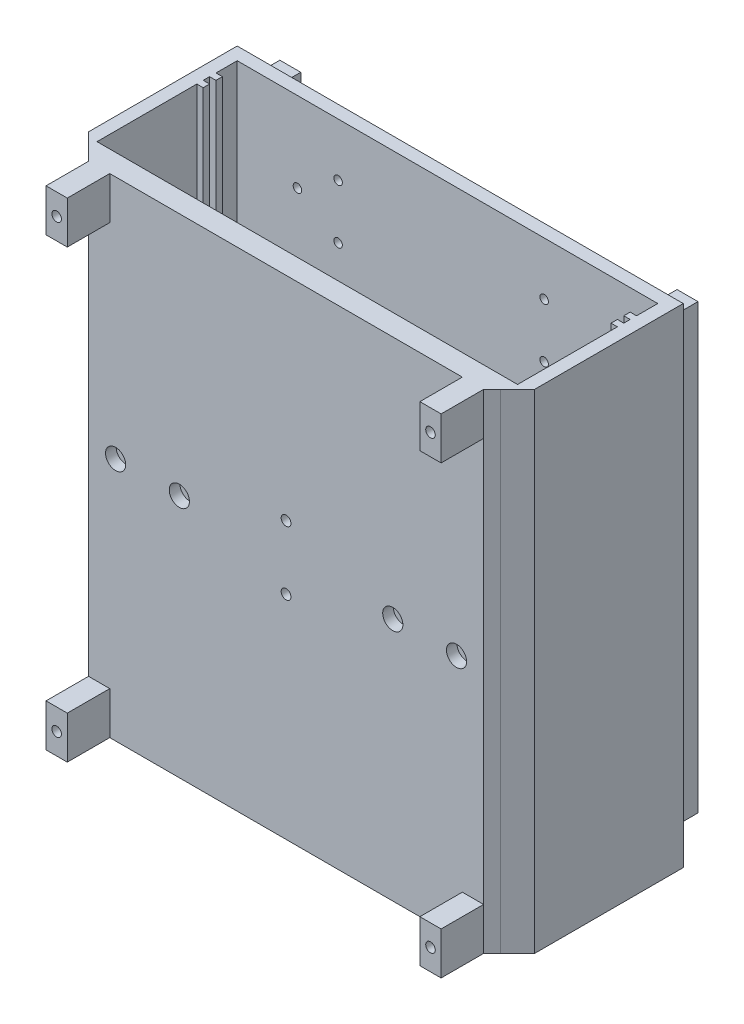
from build123d import *

# Parameters (mm, degrees)
SKETCH_1_W           = 210
SKETCH_1_H           = 230
EXTRUDE_1_DEPTH      = 6
SKETCH_2_W           = 9.85
SKETCH_2_H           = 208.5
EXTRUDE_3_DEPTH      = 15
SKETCH_3_R           = 2
CUT_EXTRUDE_1_DEPTH  = 10
SKETCH_17_W          = 6
SKETCH_17_H          = 230
EXTRUDE_9_DEPTH      = 66
EXTRUDE_10_DEPTH     = 6
CHAMFER_3_SIZE       = 8
SKETCH_21_R          = 2.3
CUT_EXTRUDE_9_DEPTH  = 6
SKETCH_34_R          = 2.25
CUT_EXTRUDE_14_DEPTH = 30
SKETCH_36_R          = 2.25
CUT_EXTRUDE_15_DEPTH = 30
SKETCH_51_W          = 194
SKETCH_51_H          = 230
EXTRUDE_22_DEPTH     = 4
CHAMFER_6_SIZE       = 4
CUT_EXTRUDE_START    = -5
SKETCH_54_R          = 4.75
SKETCH_54_R_2        = 2.3
CUT_EXTRUDE_21_DEPTH = 5
CUT_EXTRUDE_23_REACH = 324.062
SKETCH_60_W          = 25
SKETCH_60_H          = 30
SKETCH_61_W          = 3
SKETCH_61_H          = 3
EXTRUDE_25_DEPTH     = 230
SKETCH_63_W          = 5
SKETCH_63_H          = 8
EXTRUDE_26_DEPTH     = 3
SKETCH_65_W          = 5
SKETCH_65_H          = 8
EXTRUDE_27_DEPTH     = 3
SKETCH_64_R          = 1.15
CUT_EXTRUDE_24_DEPTH = 9
SKETCH_66_W          = 5
SKETCH_66_H          = 8
EXTRUDE_28_DEPTH     = 3
SKETCH_67_W          = 5
SKETCH_67_H          = 8
EXTRUDE_29_DEPTH     = 3
SKETCH_68_R          = 1.15
CUT_EXTRUDE_25_DEPTH = 9
SKETCH_69_W          = 10
SKETCH_69_H          = 20
EXTRUDE_30_DEPTH     = 20
SKETCH_70_W          = 10
SKETCH_70_H          = 20
EXTRUDE_31_DEPTH     = 20
SKETCH_72_R          = 2.25
CUT_EXTRUDE_26_DEPTH = 20


with BuildPart() as part:
    # 草图1 → 凸台-拉伸1 (new body)
    with BuildSketch(Plane.XY):
        with Locations((105, 115)):
            Rectangle(SKETCH_1_W, SKETCH_1_H)
    extrude(amount=EXTRUDE_1_DEPTH)

    # 草图2 → 凸台-拉伸3 (add)
    with BuildSketch(Plane(origin=(0, 0, 0), x_dir=(-1, 0, 0), z_dir=(0, 0, -1))):
        with Locations((-197, 115)):
            Rectangle(SKETCH_2_W, SKETCH_2_H)
        with Locations((-10, 115)):
            Rectangle(SKETCH_2_W, SKETCH_2_H)
    extrude(amount=EXTRUDE_3_DEPTH)

    # 草图3 → 切除-拉伸1 (cut)
    with BuildSketch(Plane(origin=(0, 0, 0), x_dir=(-1, 0, 0), z_dir=(0, 0, -1))):
        with Locations((-169.6425573, 192.25)):
            Circle(SKETCH_3_R)
        with Locations((-150.5, 205)):
            Circle(SKETCH_3_R)
        with Locations((-150.5, 179.5)):
            Circle(SKETCH_3_R)
        with Locations(Location((-150.5, 50.5, 0), (0, 0, 180))):
            Circle(SKETCH_3_R)
        with Locations(Location((-150.5, 25, 0), (0, 0, 180))):
            Circle(SKETCH_3_R)
        with Locations(Location((-169.6425573, 37.75, 0), (0, 0, 180))):
            Circle(SKETCH_3_R)
        with Locations((-34.3574427, 192.25)):
            Circle(SKETCH_3_R)
        with Locations((-53.5, 205)):
            Circle(SKETCH_3_R)
        with Locations((-53.5, 179.5)):
            Circle(SKETCH_3_R)
        with Locations(Location((-53.5, 50.5, 0), (0, 0, 180))):
            Circle(SKETCH_3_R)
        with Locations(Location((-53.5, 25, 0), (0, 0, 180))):
            Circle(SKETCH_3_R)
        with Locations(Location((-34.3574427, 37.75, 0), (0, 0, 180))):
            Circle(SKETCH_3_R)
    extrude(amount=-CUT_EXTRUDE_1_DEPTH, mode=Mode.SUBTRACT)

    # 草图17 → 凸台-拉伸9 (add)
    with BuildSketch(Plane.XY.offset(6)):
        with Locations((3, 115)):
            Rectangle(SKETCH_17_W, SKETCH_17_H)
        with Locations((207, 115)):
            Rectangle(SKETCH_17_W, SKETCH_17_H)
    extrude(amount=EXTRUDE_9_DEPTH)

    # 草图18 → 凸台-拉伸10 (add)
    with BuildSketch(Plane.XY.offset(72)):
        Polygon((210, 230), (204, 230), (6, 230), (0, 230), (0, 0), (6, 0), (204, 0), (210, 0), align=None)
    extrude(amount=EXTRUDE_10_DEPTH)

    # 倒角3
    chamfer_3_edges = [part.edges().sort_by_distance(p)[0] for p in [
        (210, 115, 78),
        (0, 115, 78),
    ]]
    chamfer(chamfer_3_edges, length=CHAMFER_3_SIZE)

    # 草图21 → 切除-拉伸9 (cut)
    with BuildSketch(Plane.XY.offset(72)):
        with Locations((105, 130)):
            Circle(SKETCH_21_R)
        with Locations((105, 100)):
            Circle(SKETCH_21_R)
    extrude(amount=CUT_EXTRUDE_9_DEPTH, mode=Mode.SUBTRACT)

    # 草图34 → 切除-拉伸14 (cut)
    with BuildSketch(Plane(origin=(0, 0, 72), x_dir=(-1, 0, 0), z_dir=(0, 0, -1))):
        with Locations((-185.25, 115)):
            Circle(SKETCH_34_R)
        with Locations((-155.25, 115)):
            Circle(SKETCH_34_R)
    extrude(amount=-CUT_EXTRUDE_14_DEPTH, mode=Mode.SUBTRACT)

    # 草图36 → 切除-拉伸15 (cut)
    with BuildSketch(Plane(origin=(0, 0, 72), x_dir=(-1, 0, 0), z_dir=(0, 0, -1))):
        with Locations((-54.75, 115)):
            Circle(SKETCH_36_R)
        with Locations((-24.75, 115)):
            Circle(SKETCH_36_R)
    extrude(amount=-CUT_EXTRUDE_15_DEPTH, mode=Mode.SUBTRACT)

    # 草图51 → 凸台-拉伸22 (add)
    with BuildSketch(Plane.XY.offset(78)):
        with Locations((105, 115)):
            Rectangle(SKETCH_51_W, SKETCH_51_H)
    extrude(amount=EXTRUDE_22_DEPTH)

    # 倒角6
    chamfer_6_edges = [part.edges().sort_by_distance(p)[0] for p in [
        (202, 115, 82),
        (8, 115, 82),
    ]]
    chamfer(chamfer_6_edges, length=CHAMFER_6_SIZE - 0.0001)  # a hair under: the kernel refuses the full size

    # 草图54 → 切除-拉伸21 (cut)
    with BuildSketch(Plane.XY.offset(82).offset(CUT_EXTRUDE_START)):
        with Locations((54.75, 115)):
            Circle(SKETCH_54_R)
        with Locations((105, 130)):
            Circle(SKETCH_54_R_2)
        with Locations((105, 100)):
            Circle(SKETCH_54_R_2)
        with Locations((24.75, 115)):
            Circle(SKETCH_54_R)
        with Locations((155.25, 115)):
            Circle(SKETCH_54_R)
        with Locations((185.25, 115)):
            Circle(SKETCH_54_R)
    extrude(amount=CUT_EXTRUDE_21_DEPTH, mode=Mode.SUBTRACT)

    # 草图60 → 切除-拉伸23 (cut, up to next)
    with BuildSketch(Plane.ZY, mode=Mode.PRIVATE) as cut_extrude_23_sk1:
        with Locations((51.5, 115)):
            Rectangle(SKETCH_60_W, SKETCH_60_H)
    cut_extrude_23_tool1 = extrude(cut_extrude_23_sk1.sketch, amount=-CUT_EXTRUDE_23_REACH, mode=Mode.PRIVATE) & part.part
    add(cut_extrude_23_tool1.solids().sort_by_distance((0, 115, 51.5))[0], mode=Mode.SUBTRACT)

    # 草图61 → 凸台-拉伸25 (add)
    with BuildSketch(Plane.XZ):
        with Locations((7.5, 23.5)):
            Rectangle(SKETCH_61_W, SKETCH_61_H)
        with Locations((7.5, 17.5)):
            Rectangle(SKETCH_61_W, SKETCH_61_H)
        with Locations((202.5, 17.5)):
            Rectangle(SKETCH_61_W, SKETCH_61_H)
        with Locations((202.5, 23.5)):
            Rectangle(SKETCH_61_W, SKETCH_61_H)
    extrude(amount=-EXTRUDE_25_DEPTH)

    # 草图63 → 凸台-拉伸26 (add)
    with BuildSketch(Plane.XY.offset(25)):
        with Locations((11.5, 4)):
            Rectangle(SKETCH_63_W, SKETCH_63_H)
    extrude(amount=-EXTRUDE_26_DEPTH)

    # 草图65 → 凸台-拉伸27 (add)
    with BuildSketch(Plane.XY.offset(19)):
        with Locations((11.5, 4)):
            Rectangle(SKETCH_65_W, SKETCH_65_H)
    extrude(amount=-EXTRUDE_27_DEPTH)

    # 草图64 → 切除-拉伸24 (cut)
    with BuildSketch(Plane.XY.offset(25)):
        with Locations((10, 4)):
            Circle(SKETCH_64_R)
    extrude(amount=-CUT_EXTRUDE_24_DEPTH, mode=Mode.SUBTRACT)

    # 草图66 → 凸台-拉伸28 (add)
    with BuildSketch(Plane.XY.offset(25)):
        with Locations((198.5, 4)):
            Rectangle(SKETCH_66_W, SKETCH_66_H)
    extrude(amount=-EXTRUDE_28_DEPTH)

    # 草图67 → 凸台-拉伸29 (add)
    with BuildSketch(Plane.XY.offset(19)):
        with Locations((198.5, 4)):
            Rectangle(SKETCH_67_W, SKETCH_67_H)
    extrude(amount=-EXTRUDE_29_DEPTH)

    # 草图68 → 切除-拉伸25 (cut)
    with BuildSketch(Plane.XY.offset(25)):
        with Locations((200, 4)):
            Circle(SKETCH_68_R)
    extrude(amount=-CUT_EXTRUDE_25_DEPTH, mode=Mode.SUBTRACT)

    # 草图69 → 凸台-拉伸30 (add)
    with BuildSketch(Plane.XY.offset(82)):
        with Locations((17, 10)):
            Rectangle(SKETCH_69_W, SKETCH_69_H)
    extrude(amount=EXTRUDE_30_DEPTH)

    # 草图70 → 凸台-拉伸31 (add)
    with BuildSketch(Plane.XY.offset(82)):
        with Locations((193, 10)):
            Rectangle(SKETCH_70_W, SKETCH_70_H)
        with Locations((193, 220)):
            Rectangle(SKETCH_70_W, SKETCH_70_H)
        with Locations((17, 220)):
            Rectangle(SKETCH_70_W, SKETCH_70_H)
    extrude(amount=EXTRUDE_31_DEPTH)

    # 草图72 → 切除-拉伸26 (cut)
    with BuildSketch(Plane.XY.offset(102)):
        with Locations((17, 220)):
            Circle(SKETCH_72_R)
        with Locations((193, 220)):
            Circle(SKETCH_72_R)
        with Locations((193, 10)):
            Circle(SKETCH_72_R)
        with Locations((17, 10)):
            Circle(SKETCH_72_R)
    extrude(amount=-CUT_EXTRUDE_26_DEPTH, mode=Mode.SUBTRACT)


solid = part.part
